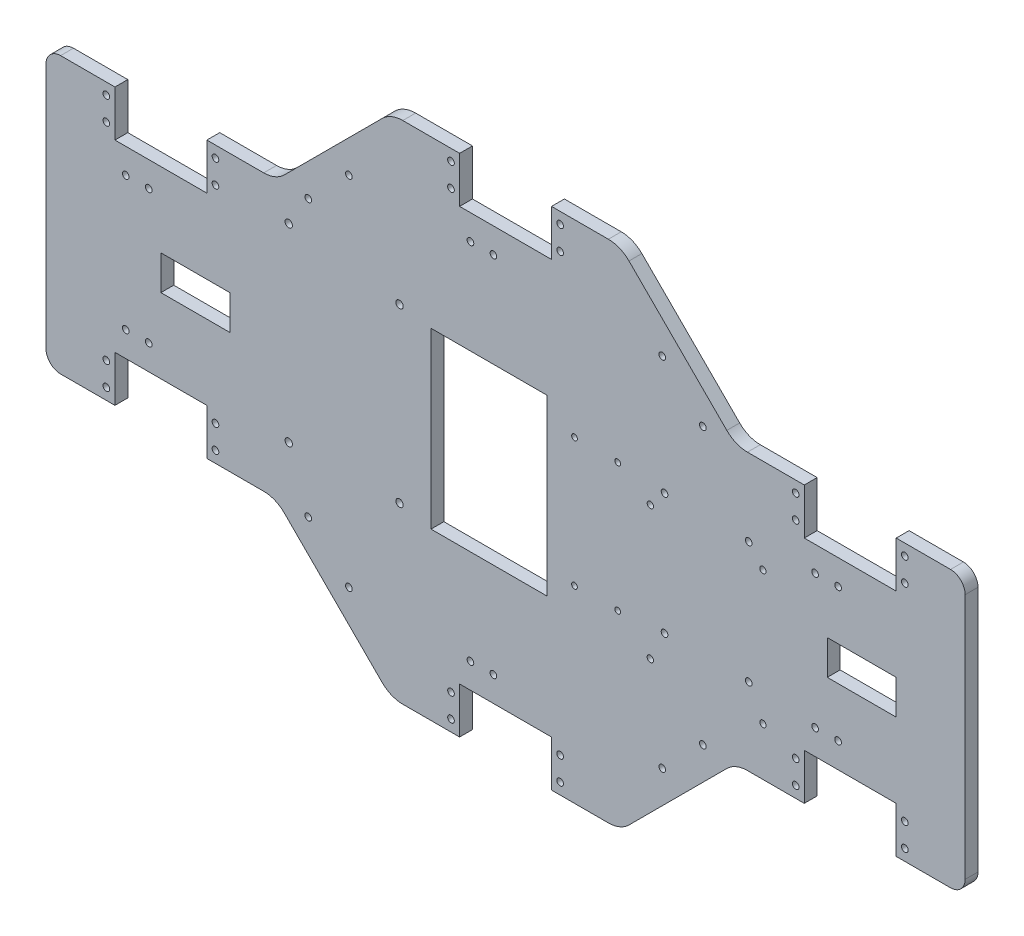
from build123d import *

# Parameters (mm, degrees)
BOSS_EXTRU_1_DEPTH       = 5.6
ENL_V_MAT_EXTRU_1_REACH  = 416.887
ESQUISSE2_W              = 40
ESQUISSE2_H              = 20
ENL_V_MAT_EXTRU_2_REACH  = 416.887
ESQUISSE3_R              = 1.45
SKETCH2_W                = 40
SKETCH2_H                = 20
CUT_EXTRUDE2_DEPTH       = 415.887165384
SKETCH5_R                = 1.45
CUT_EXTRUDE4_DEPTH       = 415.887165384
ESQUISSE4_R              = 1.375
ENL_V_MAT_EXTRU_4_DEPTH  = 415.887165384
ESQUISSE6_R              = 1.45
ENL_V_MAT_EXTRU_6_DEPTH  = 415.887165384
ESQUISSE8_R              = 1.25
ENL_V_MAT_EXTRU_7_DEPTH  = 415.887165384
ESQUISSE9_R              = 1.6
ENL_V_MAT_EXTRU_8_DEPTH  = 415.887165384
ESQUISSE10_W             = 50.45
ESQUISSE10_H             = 75.69
ENL_V_MAT_EXTRU_9_DEPTH  = 415.887165384
ESQUISSE11_W             = 30
ESQUISSE11_H             = 15
ENL_V_MAT_EXTRU_10_DEPTH = 415.887165384
ESQUISSE12_R             = 1.45
ENL_V_MAT_EXTRU_11_DEPTH = 415.887165384
FILLET1_R                = 6.35
FILLET2_R                = 12.7


with BuildPart() as part:
    # Esquisse1 → Boss.-Extru.1 (new body)
    with BuildSketch(Plane.XY):
        Polygon((100, -60), (150, -110), (250, -110), (300, -60), (400, -60), (400, 0), (25.838605695, 0), (0, 0), (0, -60), align=None)
    boss_extru_1 = extrude(amount=BOSS_EXTRU_1_DEPTH)

    # Esquisse2 → Enlèv. mat.-Extru.1 (cut, up to next)
    with BuildSketch(Plane.XY.offset(5.6), mode=Mode.PRIVATE) as enl_v_mat_extru_1_sk1:
        with Locations((50, -50)):
            Rectangle(ESQUISSE2_W, ESQUISSE2_H)
    enl_v_mat_extru_1_tool1 = extrude(enl_v_mat_extru_1_sk1.sketch, amount=-ENL_V_MAT_EXTRU_1_REACH, mode=Mode.PRIVATE) & part.part
    enl_v_mat_extru_1 = enl_v_mat_extru_1_tool1.solids().sort_by_distance((50, -50, 5.6))[0]
    add(enl_v_mat_extru_1, mode=Mode.SUBTRACT)

    # Esquisse3 → Enlèv. mat.-Extru.2 (cut, up to next)
    with BuildSketch(Plane.XY.offset(5.6), mode=Mode.PRIVATE) as enl_v_mat_extru_2_sk1:
        with Locations((26.25, -55.08)):
            Circle(ESQUISSE3_R)
    enl_v_mat_extru_2_tool1 = extrude(enl_v_mat_extru_2_sk1.sketch, amount=-ENL_V_MAT_EXTRU_2_REACH, mode=Mode.PRIVATE) & part.part
    # Esquisse3 → Enlèv. mat.-Extru.2 (cut, up to next)
    with BuildSketch(Plane.XY.offset(5.6), mode=Mode.PRIVATE) as enl_v_mat_extru_2_sk2:
        with Locations((73.75, -55.08)):
            Circle(ESQUISSE3_R)
    enl_v_mat_extru_2_tool2 = extrude(enl_v_mat_extru_2_sk2.sketch, amount=-ENL_V_MAT_EXTRU_2_REACH, mode=Mode.PRIVATE) & part.part
    # Esquisse3 → Enlèv. mat.-Extru.2 (cut, up to next)
    with BuildSketch(Plane.XY.offset(5.6), mode=Mode.PRIVATE) as enl_v_mat_extru_2_sk3:
        with Locations((73.75, -44.92)):
            Circle(ESQUISSE3_R)
    enl_v_mat_extru_2_tool3 = extrude(enl_v_mat_extru_2_sk3.sketch, amount=-ENL_V_MAT_EXTRU_2_REACH, mode=Mode.PRIVATE) & part.part
    # Esquisse3 → Enlèv. mat.-Extru.2 (cut, up to next)
    with BuildSketch(Plane.XY.offset(5.6), mode=Mode.PRIVATE) as enl_v_mat_extru_2_sk4:
        with Locations((26.25, -44.92)):
            Circle(ESQUISSE3_R)
    enl_v_mat_extru_2_tool4 = extrude(enl_v_mat_extru_2_sk4.sketch, amount=-ENL_V_MAT_EXTRU_2_REACH, mode=Mode.PRIVATE) & part.part
    # Esquisse3 → Enlèv. mat.-Extru.2 (cut, up to next)
    with BuildSketch(Plane.XY.offset(5.6), mode=Mode.PRIVATE) as enl_v_mat_extru_2_sk5:
        with Locations((34.712, -29.09)):
            Circle(ESQUISSE3_R)
    enl_v_mat_extru_2_tool5 = extrude(enl_v_mat_extru_2_sk5.sketch, amount=-ENL_V_MAT_EXTRU_2_REACH, mode=Mode.PRIVATE) & part.part
    # Esquisse3 → Enlèv. mat.-Extru.2 (cut, up to next)
    with BuildSketch(Plane.XY.offset(5.6), mode=Mode.PRIVATE) as enl_v_mat_extru_2_sk6:
        with Locations((44.712, -29.09)):
            Circle(ESQUISSE3_R)
    enl_v_mat_extru_2_tool6 = extrude(enl_v_mat_extru_2_sk6.sketch, amount=-ENL_V_MAT_EXTRU_2_REACH, mode=Mode.PRIVATE) & part.part
    enl_v_mat_extru_2_1 = enl_v_mat_extru_2_tool1.solids().sort_by_distance((26.25, -55.08, 5.6))[0]
    add(enl_v_mat_extru_2_1, mode=Mode.SUBTRACT)
    enl_v_mat_extru_2_2 = enl_v_mat_extru_2_tool2.solids().sort_by_distance((73.75, -55.08, 5.6))[0]
    add(enl_v_mat_extru_2_2, mode=Mode.SUBTRACT)
    enl_v_mat_extru_2_3 = enl_v_mat_extru_2_tool3.solids().sort_by_distance((73.75, -44.92, 5.6))[0]
    add(enl_v_mat_extru_2_3, mode=Mode.SUBTRACT)
    enl_v_mat_extru_2_4 = enl_v_mat_extru_2_tool4.solids().sort_by_distance((26.25, -44.92, 5.6))[0]
    add(enl_v_mat_extru_2_4, mode=Mode.SUBTRACT)
    enl_v_mat_extru_2_5 = enl_v_mat_extru_2_tool5.solids().sort_by_distance((34.712, -29.09, 5.6))[0]
    add(enl_v_mat_extru_2_5, mode=Mode.SUBTRACT)
    enl_v_mat_extru_2_6 = enl_v_mat_extru_2_tool6.solids().sort_by_distance((44.712, -29.09, 5.6))[0]
    add(enl_v_mat_extru_2_6, mode=Mode.SUBTRACT)
    enl_v_mat_extru_2 = enl_v_mat_extru_2_1 + enl_v_mat_extru_2_2 + enl_v_mat_extru_2_3 + enl_v_mat_extru_2_4 + enl_v_mat_extru_2_5 + enl_v_mat_extru_2_6  # Enlèv. mat.-Extru.2 as one shape, for the pattern or mirror that repeats it

    # Sketch2 → Cut-Extrude2 (cut, symmetric)
    with BuildSketch(Plane.XY):
        with Locations((350, -50)):
            Rectangle(SKETCH2_W, SKETCH2_H)
        with Locations((200, -100)):
            Rectangle(SKETCH2_W, SKETCH2_H)
    cut_extrude2 = extrude(amount=CUT_EXTRUDE2_DEPTH, both=True, mode=Mode.SUBTRACT)

    # Sketch5 → Cut-Extrude4 (cut, through all)
    with BuildSketch(Plane.XY):
        with Locations((176.25, -105.08)):
            Circle(SKETCH5_R)
        with Locations((223.75, -105.08)):
            Circle(SKETCH5_R)
        with Locations((223.75, -94.92)):
            Circle(SKETCH5_R)
        with Locations((176.25, -94.92)):
            Circle(SKETCH5_R)
        with Locations((326.25, -55.08)):
            Circle(SKETCH5_R)
        with Locations((373.75, -55.08)):
            Circle(SKETCH5_R)
        with Locations((373.75, -44.92)):
            Circle(SKETCH5_R)
        with Locations((326.25, -44.92)):
            Circle(SKETCH5_R)
        with Locations((184.712, -79.09)):
            Circle(SKETCH5_R)
        with Locations((194.712, -79.09)):
            Circle(SKETCH5_R)
        with Locations((334.712, -29.09)):
            Circle(SKETCH5_R)
        with Locations((344.712, -29.09)):
            Circle(SKETCH5_R)
    cut_extrude4 = extrude(amount=CUT_EXTRUDE4_DEPTH, mode=Mode.SUBTRACT)

    # Mirror1: Boss.-Extru.1, Enlèv. mat.-Extru.1, Enlèv. mat.-Extru.2, Cut-Extrude2, Cut-Extrude4 across plane
    add(boss_extru_1.mirror(Plane.ZX))
    add(enl_v_mat_extru_1.mirror(Plane.ZX), mode=Mode.SUBTRACT)
    add(enl_v_mat_extru_2.mirror(Plane.ZX), mode=Mode.SUBTRACT)
    add(cut_extrude2.mirror(Plane.ZX), mode=Mode.SUBTRACT)
    add(cut_extrude4.mirror(Plane.ZX), mode=Mode.SUBTRACT)

    # Esquisse4 → Enlèv. mat.-Extru.4 (cut, through all)
    with BuildSketch(Plane.XY.offset(5.6)):
        with Locations((263, -39)):
            Circle(ESQUISSE4_R)
        with Locations((312, -39)):
            Circle(ESQUISSE4_R)
        with Locations((312, 19)):
            Circle(ESQUISSE4_R)
        with Locations((263, 19)):
            Circle(ESQUISSE4_R)
    extrude(amount=-ENL_V_MAT_EXTRU_4_DEPTH, mode=Mode.SUBTRACT)

    # Esquisse6 → Enlèv. mat.-Extru.6 (cut, through all)
    with BuildSketch(Plane(origin=(0, 0, 0), x_dir=(-1, 0, 0), z_dir=(0, 0, -1))):
        with Locations((-269.19, -26.31)):
            Circle(ESQUISSE6_R)
        with Locations((-305.82, -26.31)):
            Circle(ESQUISSE6_R)
        with Locations((-305.82, 26.52)):
            Circle(ESQUISSE6_R)
        with Locations((-269.19, 26.52)):
            Circle(ESQUISSE6_R)
    extrude(amount=-ENL_V_MAT_EXTRU_6_DEPTH, mode=Mode.SUBTRACT)

    # Esquisse8 → Enlèv. mat.-Extru.7 (cut, through all)
    with BuildSketch(Plane(origin=(0, 0, 0), x_dir=(-1, 0, 0), z_dir=(0, 0, -1))):
        with Locations((-230, 27.95)):
            Circle(ESQUISSE8_R)
        with Locations((-248.8, 27.95)):
            Circle(ESQUISSE8_R)
        with Locations((-248.8, -27.95)):
            Circle(ESQUISSE8_R)
        with Locations((-230, -27.95)):
            Circle(ESQUISSE8_R)
    extrude(amount=-ENL_V_MAT_EXTRU_7_DEPTH, mode=Mode.SUBTRACT)

    # Esquisse9 → Enlèv. mat.-Extru.8 (cut, through all)
    with BuildSketch(Plane(origin=(0, 0, 0), x_dir=(-1, 0, 0), z_dir=(0, 0, -1))):
        with Locations((-153.85903462, -34.88)):
            Circle(ESQUISSE9_R)
        with Locations((-105.63903462, -36.11)):
            Circle(ESQUISSE9_R)
        with Locations((-105.63903462, 46.36)):
            Circle(ESQUISSE9_R)
        with Locations((-153.85903462, 40)):
            Circle(ESQUISSE9_R)
    extrude(amount=-ENL_V_MAT_EXTRU_8_DEPTH, mode=Mode.SUBTRACT)

    # Esquisse10 → Enlèv. mat.-Extru.9 (cut, through all)
    with BuildSketch(Plane(origin=(0, 0, 0), x_dir=(-1, 0, 0), z_dir=(0, 0, -1))):
        with Locations((-192.775, -0.005)):
            Rectangle(ESQUISSE10_W, ESQUISSE10_H)
    extrude(amount=-ENL_V_MAT_EXTRU_9_DEPTH, mode=Mode.SUBTRACT)

    # Esquisse11 → Enlèv. mat.-Extru.10 (cut, through all)
    with BuildSketch(Plane(origin=(0, 0, 0), x_dir=(-1, 0, 0), z_dir=(0, 0, -1))):
        with Locations((-355, 0)):
            Rectangle(ESQUISSE11_W, ESQUISSE11_H)
        with Locations((-65, 0)):
            Rectangle(ESQUISSE11_W, ESQUISSE11_H)
    extrude(amount=-ENL_V_MAT_EXTRU_10_DEPTH, mode=Mode.SUBTRACT)

    # Esquisse12 → Enlèv. mat.-Extru.11 (cut, through all)
    with BuildSketch(Plane.XY.offset(5.6)):
        with Locations((131.819805153, 77.67766953)):
            Circle(ESQUISSE12_R)
        with Locations((114.142135624, 60)):
            Circle(ESQUISSE12_R)
        with Locations((285.857864376, 60)):
            Circle(ESQUISSE12_R)
        with Locations((268.180194847, 77.67766953)):
            Circle(ESQUISSE12_R)
        with Locations((285.857864376, -60)):
            Circle(ESQUISSE12_R)
        with Locations((268.180194847, -77.67766953)):
            Circle(ESQUISSE12_R)
        with Locations((131.819805153, -77.67766953)):
            Circle(ESQUISSE12_R)
        with Locations((114.142135624, -60)):
            Circle(ESQUISSE12_R)
    extrude(amount=-ENL_V_MAT_EXTRU_11_DEPTH, mode=Mode.SUBTRACT)

    # Fillet1
    fillet1_edges = [part.edges().sort_by_distance(p)[0] for p in [
        (400, 60, 2.8),
        (400, -60, 2.8),
        (0, -60, 2.8),
        (0, 60, 2.8),
    ]]
    fillet(fillet1_edges, radius=FILLET1_R)

    # Fillet2
    fillet2_edges = [part.edges().sort_by_distance(p)[0] for p in [
        (150, -110, 2.8),
        (100, -60, 2.8),
        (250, -110, 2.8),
        (300, -60, 2.8),
        (300, 60, 2.8),
        (250, 110, 2.8),
        (150, 110, 2.8),
        (100, 60, 2.8),
    ]]
    fillet(fillet2_edges, radius=FILLET2_R)


solid = part.part
